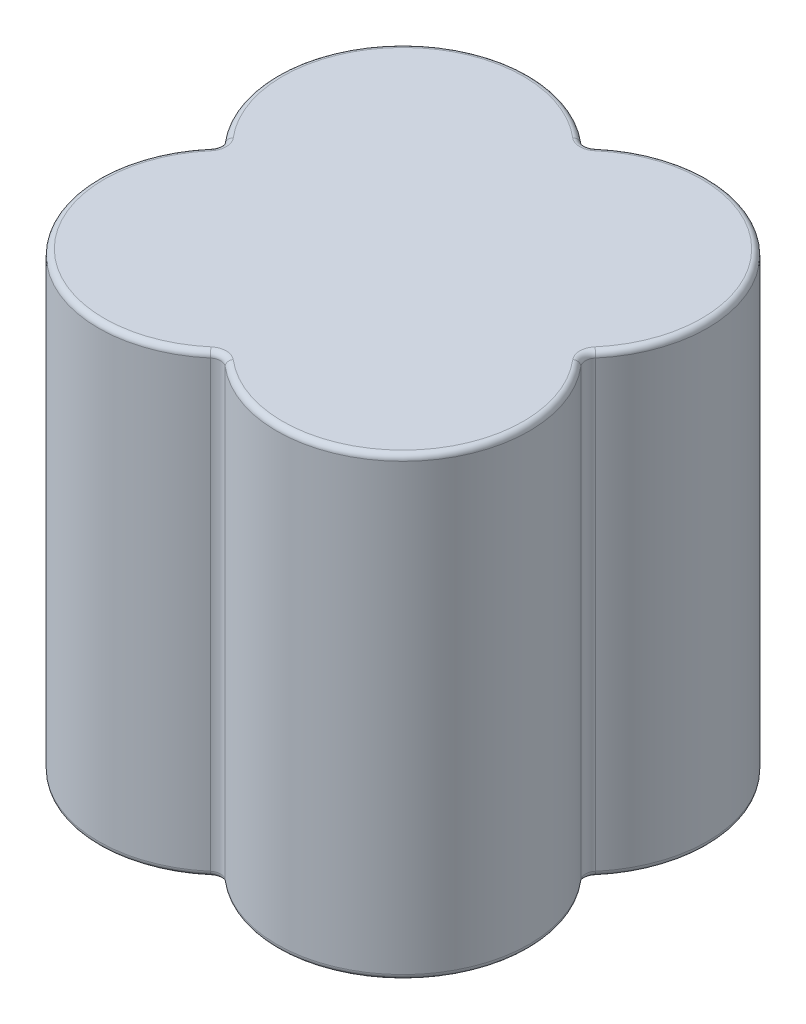
from build123d import *

# Parameters (mm, degrees)
BOSS_EXTRUDE1_DEPTH = 40
FILLET1_R           = 0.5


with BuildPart() as part:
    # Sketch1 → Boss-Extrude1 (new body)
    with BuildSketch(Plane(origin=(0, 0, 0), x_dir=(1, 0, 0), z_dir=(0, 1, 0))):
        with BuildLine():
            ThreePointArc((16.251636476, 0.648514542), (15.652893219, 15.652893219), (0.648514542, 16.251636476))
            ThreePointArc((0.648514542, 16.251636476), (0, 16.012838742), (-0.648514542, 16.251636476))
            ThreePointArc((-0.648514542, 16.251636476), (-15.652893219, 15.652893219), (-16.251636476, 0.648514542))
            ThreePointArc((-16.251636476, 0.648514542), (-16.012838742, 0), (-16.251636476, -0.648514542))
            ThreePointArc((-16.251636476, -0.648514542), (-15.652893219, -15.652893219), (-0.648514542, -16.251636476))
            ThreePointArc((-0.648514542, -16.251636476), (0, -16.012838742), (0.648514542, -16.251636476))
            ThreePointArc((0.648514542, -16.251636476), (15.652893219, -15.652893219), (16.251636476, -0.648514542))
            ThreePointArc((16.251636476, -0.648514542), (16.012838742, 0), (16.251636476, 0.648514542))
        make_face()
    extrude(amount=BOSS_EXTRUDE1_DEPTH)

    # Fillet1
    fillet1_edges = [part.edges().sort_by_distance(p)[0] for p in [
        (-15.652893219, 0, 15.652893219),
        (0, 0, 16.012838742),
        (15.652893219, 0, 15.652893219),
        (16.012838742, 0, 0),
        (15.652893219, 0, -15.652893219),
        (0, 0, -16.012838742),
        (-15.652893219, 0, -15.652893219),
        (-16.012838742, 0, 0),
        (-15.652893219, 40, -15.652893219),
        (0, 40, -16.012838742),
        (15.652893219, 40, -15.652893219),
        (16.012838742, 40, 0),
        (15.652893219, 40, 15.652893219),
        (0, 40, 16.012838742),
        (-15.652893219, 40, 15.652893219),
        (-16.012838742, 40, 0),
    ]]
    fillet(fillet1_edges, radius=FILLET1_R)


solid = part.part
